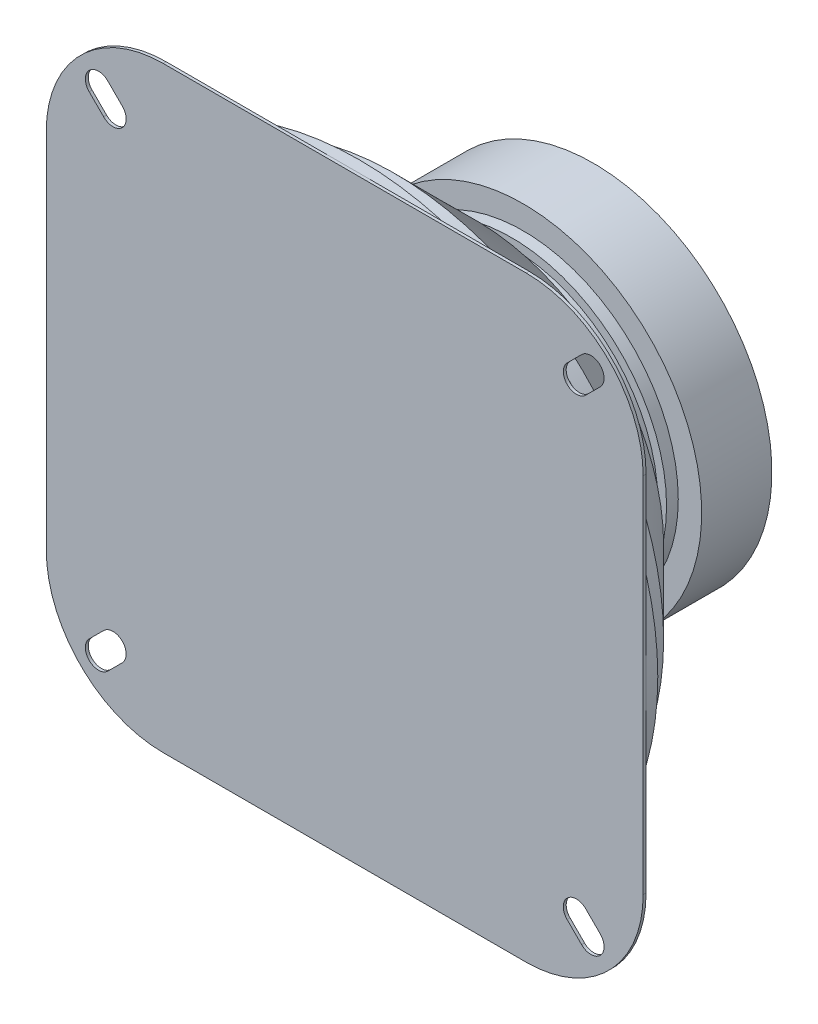
from build123d import *

# Parameters (mm, degrees)
ESQUISSE1_R             = 26.5
BOSS_EXTRU_1_DEPTH      = 16
ESQUISSE4_R             = 25
BOSS_EXTRU_2_DEPTH      = 6
ESQUISSE5_R             = 46
BOSS_EXTRU_3_DEPTH      = 14
CHANFREIN1_SIZE         = 14
ESQUISSE6_R             = 46
BOSS_EXTRU_4_DEPTH      = 6
ESQUISSE7_R             = 51
BOSS_EXTRU_5_DEPTH      = 2
BOSS_EXTRU_6_DEPTH      = 0.5
ESQUISSE9_R             = 30.5
BOSS_EXTRU_7_DEPTH      = 14
ESQUISSE10_R            = 30.5
ESQUISSE10_R_2          = 26.5
ENL_V_MAT_EXTRU_1_DEPTH = 2


with BuildPart() as part:
    # Esquisse1 → Boss.-Extru.1 (new body)
    with BuildSketch(Plane.XY):
        Circle(ESQUISSE1_R)
    extrude(amount=BOSS_EXTRU_1_DEPTH)

    # Esquisse4 → Boss.-Extru.2 (add)
    with BuildSketch(Plane.XY.offset(16)):
        Circle(ESQUISSE4_R)
    extrude(amount=BOSS_EXTRU_2_DEPTH)

    # Esquisse5 → Boss.-Extru.3 (add)
    with BuildSketch(Plane.XY.offset(22)):
        Circle(ESQUISSE5_R)
    extrude(amount=BOSS_EXTRU_3_DEPTH)

    # Chanfrein1
    chanfrein1_edges = [part.edges().sort_by_distance(p)[0] for p in [
        (-46, 0, 22),
    ]]
    chamfer(chanfrein1_edges, length=CHANFREIN1_SIZE - 0.0001)  # a hair under: the kernel refuses the full size

    # Esquisse6 → Boss.-Extru.4 (add)
    with BuildSketch(Plane.XY.offset(36)):
        Circle(ESQUISSE6_R)
    extrude(amount=BOSS_EXTRU_4_DEPTH)

    # Esquisse7 → Boss.-Extru.5 (add)
    with BuildSketch(Plane.XY.offset(42)):
        Circle(ESQUISSE7_R)
    extrude(amount=BOSS_EXTRU_5_DEPTH)

    # Esquisse8 → Boss.-Extru.6 (add)
    with BuildSketch(Plane.XY.offset(44)):
        with BuildLine():
            ThreePointArc((-51, -31), (-49.47759065, -38.653668647), (-45.142135624, -45.142135624))
            Line((-45.142135624, -45.142135624), (-43.663843738, -43.663843738))
            ThreePointArc((-43.663843738, -43.663843738), (-44.322853481, -42.072853481), (-43.663843738, -40.481863223))
            Line((-43.663843738, -40.481863223), (-41.188970004, -38.006989489))
            ThreePointArc((-41.188970004, -38.006989489), (-39.597979746, -37.347979746), (-38.006989489, -38.006989489))
            Line((-38.006989489, -38.006989489), (-36.062445841, -36.062445841))
            ThreePointArc((-36.062445841, -36.062445841), (-47.117856123, -19.516855134), (-51, -1.81e-07))
            Line((-51, -1.81e-07), (-51, -31))
        make_face()
        with BuildLine():
            Line((-43.663843738, -43.663843738), (-45.142135624, -45.142135624))
            ThreePointArc((-45.142135624, -45.142135624), (-38.653668647, -49.47759065), (-31, -51))
            Line((-31, -51), (6e-08, -51))
            ThreePointArc((6e-08, -51), (-19.516855023, -47.11785617), (-36.062445841, -36.062445841))
            Line((-36.062445841, -36.062445841), (-38.006989489, -38.006989489))
            ThreePointArc((-38.006989489, -38.006989489), (-37.347979746, -39.597979746), (-38.006989489, -41.188970004))
            Line((-38.006989489, -41.188970004), (-40.481863223, -43.663843738))
            ThreePointArc((-40.481863223, -43.663843738), (-42.072853481, -44.322853481), (-43.663843738, -43.663843738))
        make_face()
        with BuildLine():
            ThreePointArc((-36.062445841, -36.062445841), (-19.516855023, -47.11785617), (6e-08, -51))
            ThreePointArc((6e-08, -51), (19.516855078, -47.117856147), (36.062445841, -36.062445841))
            Line((36.062445841, -36.062445841), (0, 0))
            Line((0, 0), (-36.062445841, -36.062445841))
        make_face()
        with BuildLine():
            ThreePointArc((-36.062445841, 36.062445841), (-47.117856193, 19.516854967), (-51, -1.81e-07))
            ThreePointArc((-51, -1.81e-07), (-47.117856123, -19.516855134), (-36.062445841, -36.062445841))
            Line((-36.062445841, -36.062445841), (0, 0))
            Line((0, 0), (-36.062445841, 36.062445841))
        make_face()
        with BuildLine():
            Line((0, 0), (36.062445841, -36.062445841))
            ThreePointArc((36.062445841, -36.062445841), (47.117856158, -19.516855051), (51, 0))
            ThreePointArc((51, 0), (47.117856158, 19.516855051), (36.062445841, 36.062445841))
            Line((36.062445841, 36.062445841), (0, 0))
        make_face()
        with BuildLine():
            ThreePointArc((1.95e-07, 51), (-19.516854961, 47.117856195), (-36.062445841, 36.062445841))
            Line((-36.062445841, 36.062445841), (0, 0))
            Line((0, 0), (36.062445841, 36.062445841))
            ThreePointArc((36.062445841, 36.062445841), (19.516855141, 47.117856121), (1.95e-07, 51))
        make_face()
        with BuildLine():
            ThreePointArc((36.062445841, -36.062445841), (19.516855078, -47.117856147), (6e-08, -51))
            Line((6e-08, -51), (31, -51))
            ThreePointArc((31, -51), (38.653668647, -49.47759065), (45.142135624, -45.142135624))
            Line((45.142135624, -45.142135624), (43.663843738, -43.663843738))
            ThreePointArc((43.663843738, -43.663843738), (42.072853481, -44.322853481), (40.481863223, -43.663843738))
            Line((40.481863223, -43.663843738), (38.006989489, -41.188970004))
            ThreePointArc((38.006989489, -41.188970004), (37.347979746, -39.597979746), (38.006989489, -38.006989489))
            Line((38.006989489, -38.006989489), (36.062445841, -36.062445841))
        make_face()
        with BuildLine():
            ThreePointArc((51, 0), (47.117856158, -19.516855051), (36.062445841, -36.062445841))
            Line((36.062445841, -36.062445841), (38.006989489, -38.006989489))
            ThreePointArc((38.006989489, -38.006989489), (39.597979746, -37.347979746), (41.188970004, -38.006989489))
            Line((41.188970004, -38.006989489), (43.663843738, -40.481863223))
            ThreePointArc((43.663843738, -40.481863223), (44.322853481, -42.072853481), (43.663843738, -43.663843738))
            Line((43.663843738, -43.663843738), (45.142135624, -45.142135624))
            ThreePointArc((45.142135624, -45.142135624), (49.47759065, -38.653668647), (51, -31))
            Line((51, -31), (51, 0))
        make_face()
        with BuildLine():
            ThreePointArc((36.062445841, 36.062445841), (47.117856158, 19.516855051), (51, 0))
            Line((51, 0), (51, 31))
            ThreePointArc((51, 31), (49.47759065, 38.653668647), (45.142135624, 45.142135624))
            Line((45.142135624, 45.142135624), (43.663843738, 43.663843738))
            ThreePointArc((43.663843738, 43.663843738), (44.322853481, 42.072853481), (43.663843738, 40.481863223))
            Line((43.663843738, 40.481863223), (41.188970004, 38.006989489))
            ThreePointArc((41.188970004, 38.006989489), (39.597979746, 37.347979746), (38.006989489, 38.006989489))
            Line((38.006989489, 38.006989489), (36.062445841, 36.062445841))
        make_face()
        with BuildLine():
            Line((31, 51), (1.95e-07, 51))
            ThreePointArc((1.95e-07, 51), (19.516855141, 47.117856121), (36.062445841, 36.062445841))
            Line((36.062445841, 36.062445841), (38.006989489, 38.006989489))
            ThreePointArc((38.006989489, 38.006989489), (37.347979746, 39.597979746), (38.006989489, 41.188970004))
            Line((38.006989489, 41.188970004), (40.481863223, 43.663843738))
            ThreePointArc((40.481863223, 43.663843738), (42.072853481, 44.322853481), (43.663843738, 43.663843738))
            Line((43.663843738, 43.663843738), (45.142135624, 45.142135624))
            ThreePointArc((45.142135624, 45.142135624), (38.653668647, 49.47759065), (31, 51))
        make_face()
        with BuildLine():
            Line((-38.006989489, 38.006989489), (-36.062445841, 36.062445841))
            ThreePointArc((-36.062445841, 36.062445841), (-19.516854961, 47.117856195), (1.95e-07, 51))
            Line((1.95e-07, 51), (-31, 51))
            ThreePointArc((-31, 51), (-38.653668647, 49.47759065), (-45.142135624, 45.142135624))
            Line((-45.142135624, 45.142135624), (-43.663843738, 43.663843738))
            ThreePointArc((-43.663843738, 43.663843738), (-42.072853481, 44.322853481), (-40.481863223, 43.663843738))
            Line((-40.481863223, 43.663843738), (-38.006989489, 41.188970004))
            ThreePointArc((-38.006989489, 41.188970004), (-37.347979746, 39.597979746), (-38.006989489, 38.006989489))
        make_face()
        with BuildLine():
            Line((-51, 31), (-51, -1.81e-07))
            ThreePointArc((-51, -1.81e-07), (-47.117856193, 19.516854967), (-36.062445841, 36.062445841))
            Line((-36.062445841, 36.062445841), (-38.006989489, 38.006989489))
            ThreePointArc((-38.006989489, 38.006989489), (-39.597979746, 37.347979746), (-41.188970004, 38.006989489))
            Line((-41.188970004, 38.006989489), (-43.663843738, 40.481863223))
            ThreePointArc((-43.663843738, 40.481863223), (-44.322853481, 42.072853481), (-43.663843738, 43.663843738))
            Line((-43.663843738, 43.663843738), (-45.142135624, 45.142135624))
            ThreePointArc((-45.142135624, 45.142135624), (-49.47759065, 38.653668647), (-51, 31))
        make_face()
    extrude(amount=BOSS_EXTRU_6_DEPTH)


with BuildPart() as body_2:
    # Esquisse9 → Boss.-Extru.7 (new body)
    with BuildSketch(Plane(origin=(0, 0, 0), x_dir=(-1, 0, 0), z_dir=(0, 0, -1))):
        Circle(ESQUISSE9_R)
    extrude(amount=-BOSS_EXTRU_7_DEPTH)

    # Esquisse10 → Enlèv. mat.-Extru.1 (cut)
    with BuildSketch(Plane(origin=(0, 0, 0), x_dir=(-1, 0, 0), z_dir=(0, 0, -1))):
        Circle(ESQUISSE10_R)
        Circle(ESQUISSE10_R_2, mode=Mode.SUBTRACT)
    extrude(amount=-ENL_V_MAT_EXTRU_1_DEPTH, mode=Mode.SUBTRACT)


solid = Compound([part.part, body_2.part])
